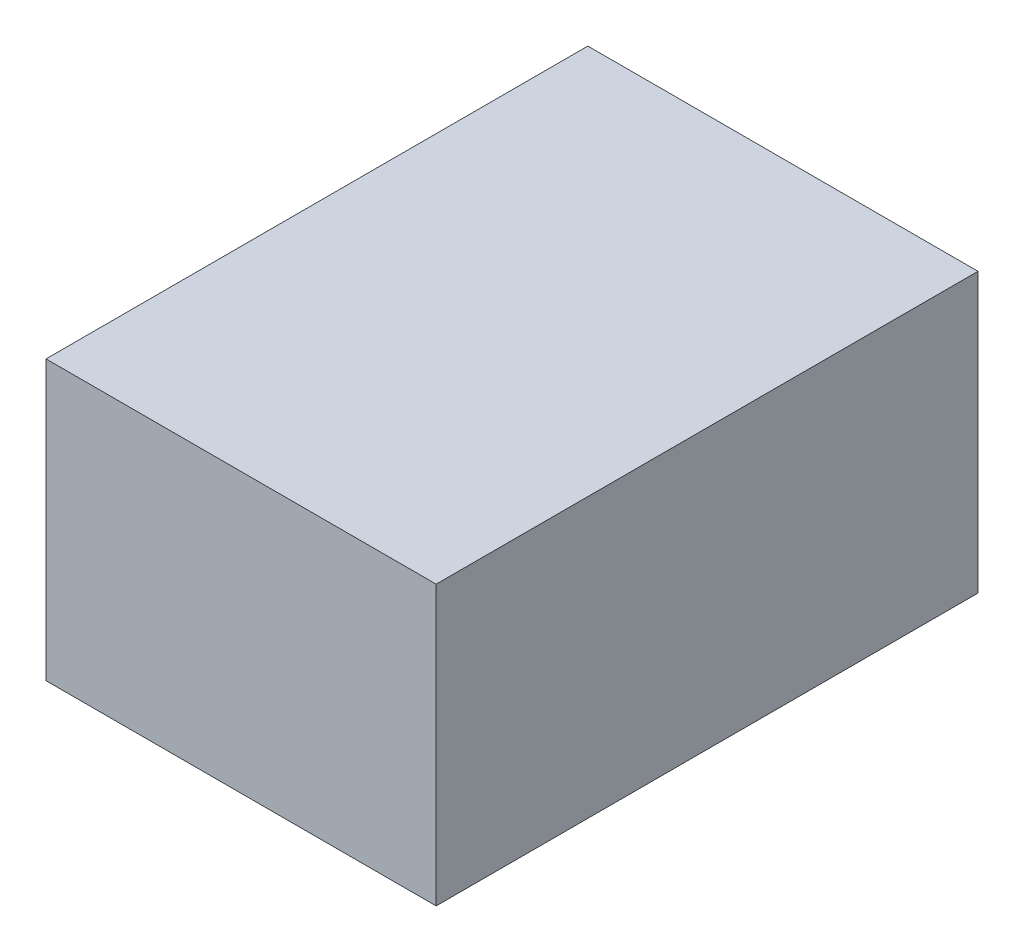
from build123d import *

# Parameters (mm, degrees)
BOSS_EXTRUDE1_DEPTH      = 22.86
BOSS_EXTRUDE1_DEPTH_BACK = 22.86
SKETCH1_W                = 64.008
SKETCH1_H                = 88.9


with BuildPart() as part:
    # Sketch1 → Boss-Extrude1 (new, two sides: drawn at the far end of the back side and taken through both)
    with BuildSketch(Plane(origin=(0, 0, 0), x_dir=(1, 0, 0), z_dir=(0, 1, 0)).offset(-BOSS_EXTRUDE1_DEPTH_BACK)):
        Rectangle(SKETCH1_W, SKETCH1_H)
    extrude(amount=BOSS_EXTRUDE1_DEPTH + BOSS_EXTRUDE1_DEPTH_BACK)


solid = part.part
